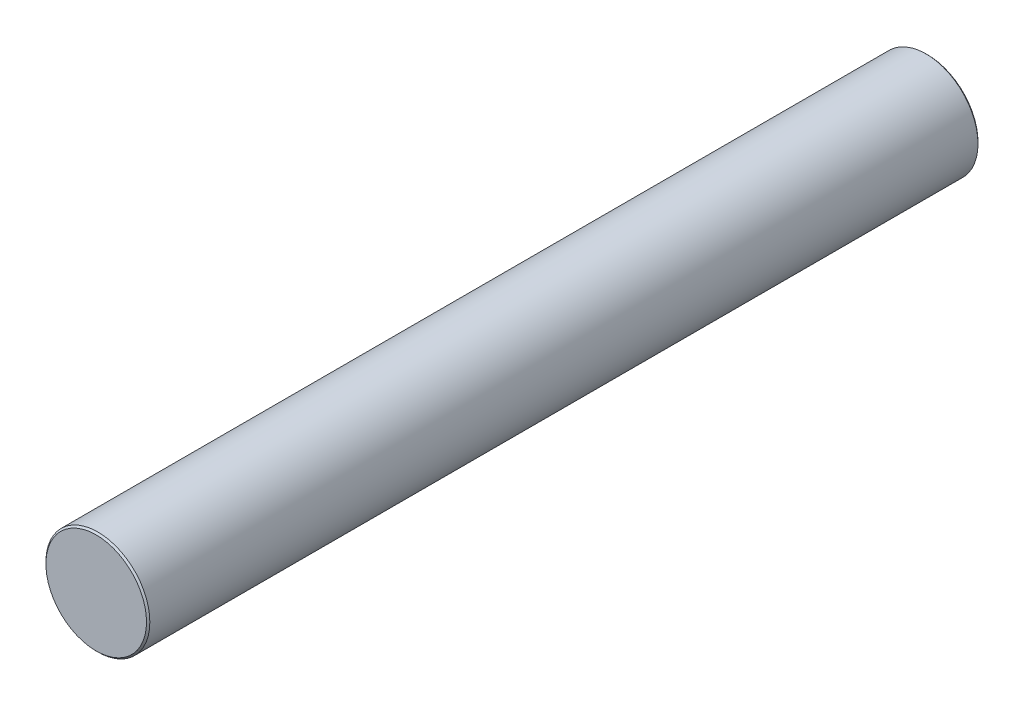
from build123d import *

# Parameters (mm, degrees)
SKETCH1_R           = 7.9375
BOSS_EXTRUDE1_DEPTH = 127
CHAMFER1_SIZE       = 0.254


with BuildPart() as part:
    # Sketch1 → Boss-Extrude1 (new body)
    with BuildSketch(Plane.XY):
        Circle(SKETCH1_R)
    extrude(amount=BOSS_EXTRUDE1_DEPTH)

    # Chamfer1
    chamfer1_edges = [part.edges().sort_by_distance(p)[0] for p in [
        (-7.9375, 0, 0),
        (-7.9375, 0, 127),
    ]]
    chamfer(chamfer1_edges, length=CHAMFER1_SIZE)


solid = part.part
